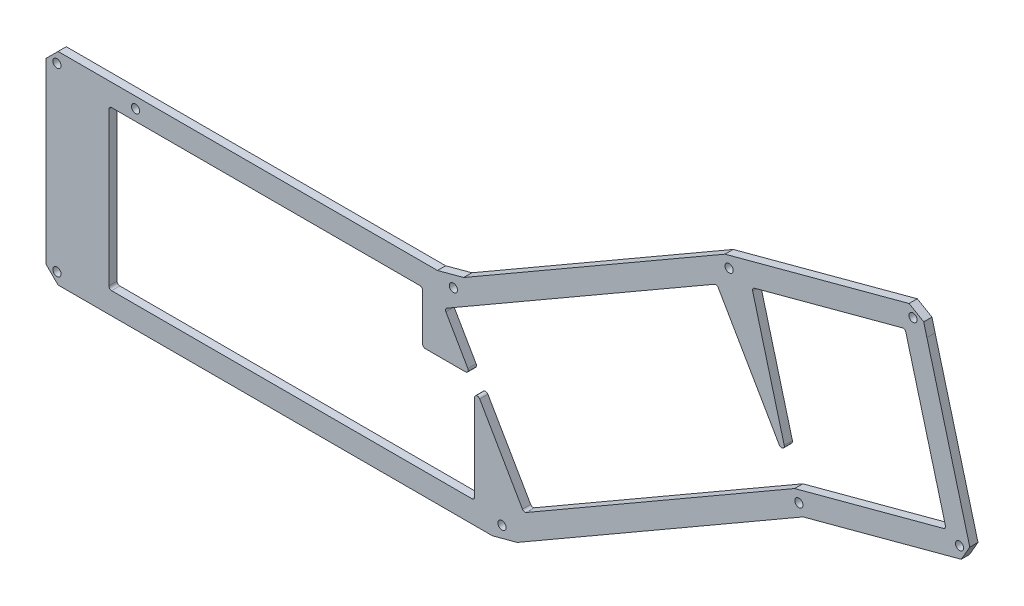
from build123d import *

# Parameters (mm, degrees)
ESQUISSE1_R        = 1.5
BOSS_EXTRU_1_DEPTH = 3


with BuildPart() as part:
    # Esquisse1 → Boss.-Extru.1 (new body)
    with BuildSketch(Plane.XY):
        Polygon((148.601875371, 105.837072147), (53.020699849, 50.65325473), (43.436239735, 48.085106383), (-75.988646329, 48.085106383), (-95.339549, 48.085106383), (-99.753762562, 43.670892821), (-99.753762562, 35.79522772), (-99.753762562, -21.500680055), (-95.339549, -25.914893617), (63.537073365, -25.914893617), (72.612867289, -23.483041964), (177.164809225, 36.880049857), (235.028816504, 52.384663878), (238.150136848, 57.7909493), (227.128124267, 98.925660253), (222.468634592, 116.315112458), (221.306984889, 120.752734555), (215.930320526, 123.877674654), (211.446677613, 122.676286156), align=None)
        with Locations((-95.753762562, 44.085106383)):
            Circle(ESQUISSE1_R, mode=Mode.SUBTRACT)
        with Locations((-95.753762562, -21.914893617)):
            Circle(ESQUISSE1_R, mode=Mode.SUBTRACT)
        with Locations((67.039694146, -20.835264486)):
            Circle(ESQUISSE1_R, mode=Mode.SUBTRACT)
        with Locations((49.263745973, 45.505477252)):
            Circle(ESQUISSE1_R, mode=Mode.SUBTRACT)
        with Locations((175.637377655, 40.567595866)):
            Circle(ESQUISSE1_R, mode=Mode.SUBTRACT)
        with Locations((150.12930694, 102.149526137)):
            Circle(ESQUISSE1_R, mode=Mode.SUBTRACT)
        with Locations((234.393639901, 56.355573542)):
            Circle(ESQUISSE1_R, mode=Mode.SUBTRACT)
        with Locations((217.363403759, 120.120565138)):
            Circle(ESQUISSE1_R, mode=Mode.SUBTRACT)
        with Locations((-66.988646329, 44.085106383)):
            Circle(ESQUISSE1_R, mode=Mode.SUBTRACT)
        with BuildLine():
            Line((-76.753762562, 39.085106383), (-76.753762562, -16.914893617))
            ThreePointArc((-76.753762562, -16.914893617), (-76.460869343, -17.622000398), (-75.753762562, -17.914893617))
            Line((-75.753762562, -17.914893617), (56.011353671, -17.914893617))
            ThreePointArc((56.011353671, -17.914893617), (56.718460453, -17.622000398), (57.011353671, -16.914893617))
            Line((57.011353671, -16.914893617), (57.011353671, 14.621004768))
            ThreePointArc((57.011353671, 14.621004768), (57.752534626, 15.586930594), (58.877379075, 15.121004768))
            Line((58.877379075, 15.121004768), (74.527293708, -11.98544251))
            ThreePointArc((74.527293708, -11.98544251), (75.134500067, -12.451368337), (75.893319112, -12.351467914))
            Line((75.893319112, -12.351467914), (174.076924484, 44.334863077))
            Line((174.076924484, 44.334863077), (228.528734589, 58.925181621))
            ThreePointArc((228.528734589, 58.925181621), (229.135940948, 59.391107448), (229.235841371, 60.149926493))
            Line((229.235841371, 60.149926493), (214.741974845, 114.241772765))
            ThreePointArc((214.741974845, 114.241772765), (214.276049019, 114.848979124), (213.517229973, 114.948879546))
            Line((213.517229973, 114.948879546), (159.425383701, 100.45501302))
            ThreePointArc((159.425383701, 100.45501302), (158.818177343, 99.989087194), (158.71827692, 99.230268149))
            Line((158.71827692, 99.230268149), (170.271736655, 56.112169417))
            ThreePointArc((170.271736655, 56.112169417), (169.688494261, 54.929470839), (168.439785425, 55.353350371))
            Line((168.439785425, 55.353350371), (146.120215143, 94.011980101))
            ThreePointArc((146.120215143, 94.011980101), (145.513008785, 94.477905928), (144.75418974, 94.378005505))
            Line((144.75418974, 94.378005505), (46.893319112, 37.878005505))
            ThreePointArc((46.893319112, 37.878005505), (46.427393286, 37.270799147), (46.527293708, 36.511980101))
            Line((46.527293708, 36.511980101), (54.567977999, 22.585106383))
            ThreePointArc((54.567977999, 22.585106383), (54.567977999, 21.585106383), (53.701952595, 21.085106383))
            Line((53.701952595, 21.085106383), (39.011353671, 21.085106383))
            ThreePointArc((39.011353671, 21.085106383), (38.30424689, 21.377999602), (38.011353671, 22.085106383))
            Line((38.011353671, 22.085106383), (38.011353671, 39.085106383))
            ThreePointArc((38.011353671, 39.085106383), (37.718460453, 39.792213164), (37.011353671, 40.085106383))
            Line((37.011353671, 40.085106383), (-75.753762562, 40.085106383))
            ThreePointArc((-75.753762562, 40.085106383), (-76.460869343, 39.792213164), (-76.753762562, 39.085106383))
        make_face(mode=Mode.SUBTRACT)
    extrude(amount=BOSS_EXTRU_1_DEPTH)


solid = part.part
